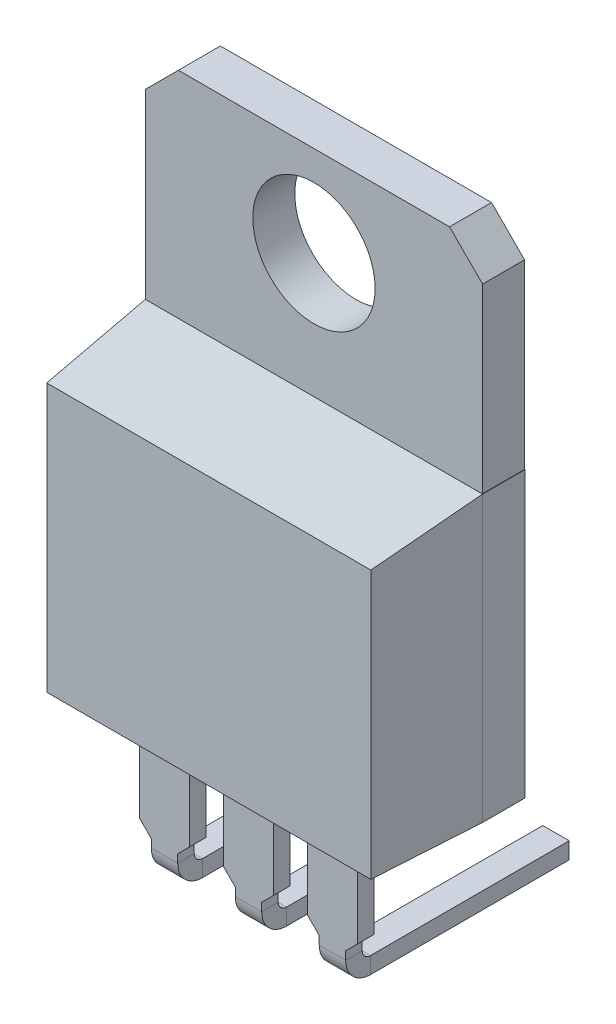
from build123d import *

# Parameters (mm, degrees)
ESQUISSE1_W              = 10.2
ESQUISSE1_H              = 15.1
ESQUISSE1_R              = 1.85
BOSS_EXTRU_1_DEPTH       = 1.27
ESQUISSE2_W              = 10.2
ESQUISSE2_H              = 8.6
BOSS_EXTRU_2_DEPTH       = 3.18
ENL_V_MAT_EXTRU_1_DEPTH  = 11.944062317
ENL_V_MAT_EXTRU_2_DEPTH  = 19.757731739
ESQUISSE5_W              = 1.5
ESQUISSE5_H              = 0.5
BOSS_EXTRU_3_DEPTH       = 3.1
ESQUISSE6_W              = 0.8
ESQUISSE6_H              = 0.5
BOSS_EXTRU_4_DEPTH       = 3.5
CHANFREIN1_SIZE          = 0.35
CHANFREIN2_SIZE          = 1
ESQUISSE8_W              = 1.27
ESQUISSE8_H              = 5.5
ENL_V_MAT_EXTRU_4_DEPTH  = 0.01
ESQUISSE9_W              = 1.27
ESQUISSE9_H              = 5.5
ENL_V_MAT_EXTRU_5_DEPTH  = 0.01
BOSS_EXTRU_6_DEPTH       = 0.01
ESQUISSE12_W             = 5.88
ESQUISSE12_H             = 3.15
ENL_V_MAT_EXTRU_15_DEPTH = 17.267993115
BALAYAGE1_START          = -2.94
BALAYAGE1_DEPTH          = 0.8
BALAYAGE2_START          = 2.14
BALAYAGE2_DEPTH          = 0.8
BALAYAGE3_START          = -0.4
BALAYAGE3_DEPTH          = 0.8


# Read off the part's stored shape, not the designer's step: Balayage1, Balayage2, Balayage3
with BuildPart() as part:
    # Esquisse1 → Boss.-Extru.1 (new body)
    with BuildSketch(Plane.XY):
        with Locations((0, 7.55)):
            Rectangle(ESQUISSE1_W, ESQUISSE1_H)
        with Locations((0, 12.36)):
            Circle(ESQUISSE1_R, mode=Mode.SUBTRACT)
    extrude(amount=BOSS_EXTRU_1_DEPTH)

    # Esquisse2 → Boss.-Extru.2 (add)
    with BuildSketch(Plane.XY.offset(1.27)):
        with Locations((0, 4.3)):
            Rectangle(ESQUISSE2_W, ESQUISSE2_H)
    extrude(amount=BOSS_EXTRU_2_DEPTH)

    # Esquisse3 → Enlèv. mat.-Extru.1 (cut, through all)
    with BuildSketch(Plane(origin=(0, 8.6, 0), x_dir=(1, 0, 0), z_dir=(0, 1, 0))):
        Polygon((5.1, -1.27), (4.9, -4.45), (5.1, -4.45), align=None)
        Polygon((-5.1, -1.27), (-5.1, -4.45), (-4.9, -4.45), align=None)
    extrude(amount=-ENL_V_MAT_EXTRU_1_DEPTH, mode=Mode.SUBTRACT)

    # Esquisse4 → Enlèv. mat.-Extru.2 (cut, through all)
    with BuildSketch(Plane(origin=(5.1, 0, 0), x_dir=(0, 0, -1), z_dir=(1, 0, 0))):
        Polygon((-1.27, 8.6), (-4.45, 8.1), (-4.45, 8.6), align=None)
    extrude(amount=-ENL_V_MAT_EXTRU_2_DEPTH, mode=Mode.SUBTRACT)

    # Esquisse5 → Boss.-Extru.3 (add)
    with BuildSketch(Plane.XZ):
        with Locations((0, 3)):
            Rectangle(ESQUISSE5_W, ESQUISSE5_H)
        with Locations((2.54, 3)):
            Rectangle(ESQUISSE5_W, ESQUISSE5_H)
        with Locations((-2.54, 3)):
            Rectangle(ESQUISSE5_W, ESQUISSE5_H)
    extrude(amount=BOSS_EXTRU_3_DEPTH)

    # Esquisse6 → Boss.-Extru.4 (add)
    with BuildSketch(Plane.XZ.offset(3.1)):
        with Locations((-2.54, 3)):
            Rectangle(ESQUISSE6_W, ESQUISSE6_H)
        with Locations((0, 3)):
            Rectangle(ESQUISSE6_W, ESQUISSE6_H)
        with Locations((2.54, 3)):
            Rectangle(ESQUISSE6_W, ESQUISSE6_H)
    extrude(amount=BOSS_EXTRU_4_DEPTH)

    # Chanfrein1
    chanfrein1_edges = [part.edges().sort_by_distance(p)[0] for p in [
        (2.94, -3.1, 3),
        (0.4, -3.1, 3),
        (-2.14, -3.1, 3),
        (2.14, -3.1, 3),
        (-0.4, -3.1, 3),
        (-2.94, -3.1, 3),
    ]]
    chamfer(chanfrein1_edges, length=CHANFREIN1_SIZE - 0.0001)  # a hair under: the kernel refuses the full size

    # Chanfrein2
    chanfrein2_edges = [part.edges().sort_by_distance(p)[0] for p in [
        (-5.1, 15.1, 0.635),
        (5.1, 15.1, 0.635),
    ]]
    chamfer(chanfrein2_edges, length=CHANFREIN2_SIZE)

    # Esquisse8 → Enlèv. mat.-Extru.4 (cut)
    with BuildSketch(Plane(origin=(5.1, 0, 0), x_dir=(0, 0, -1), z_dir=(1, 0, 0))):
        with Locations((-0.635, 11.35)):
            Rectangle(ESQUISSE8_W, ESQUISSE8_H)
    extrude(amount=-ENL_V_MAT_EXTRU_4_DEPTH, mode=Mode.SUBTRACT)

    # Esquisse9 → Enlèv. mat.-Extru.5 (cut)
    with BuildSketch(Plane.ZY.offset(5.1)):
        with Locations((0.635, 11.35)):
            Rectangle(ESQUISSE9_W, ESQUISSE9_H)
    extrude(amount=-ENL_V_MAT_EXTRU_5_DEPTH, mode=Mode.SUBTRACT)

    # Esquisse11 → Boss.-Extru.6 (add)
    with BuildSketch(Plane(origin=(0, 0, 0), x_dir=(-1, 0, 0), z_dir=(0, 0, -1))):
        Polygon((-5.1, 0), (-5.1, 8.6), (-3.6, 8.6), (-3.6, 2), (3.59, 2), (3.59, 8.6), (5.09, 8.6), (5.1, 0), align=None)
    extrude(amount=BOSS_EXTRU_6_DEPTH)

    # Esquisse12 → Enlèv. mat.-Extru.15 (cut, through all)
    with BuildSketch(Plane.XY.offset(3.25)):
        with Locations((0, -5.025)):
            Rectangle(ESQUISSE12_W, ESQUISSE12_H)
    extrude(amount=-ENL_V_MAT_EXTRU_15_DEPTH, mode=Mode.SUBTRACT)

    # Balayage1 outline → Balayage1 (add)
    with BuildSketch(Plane.YZ.offset(BALAYAGE1_START)):
        with BuildLine():
            Line((-4.45, 2.5), (-4.45, -3.51))
            Line((-4.45, -3.51), (-3.95, -3.51))
            Line((-3.95, -3.51), (-3.95, 2.5))
            ThreePointArc((-3.95, 2.5), (-3.876776695, 2.676776695), (-3.7, 2.75))
            Line((-3.7, 2.75), (-3.45, 2.750000001))
            Line((-3.45, 2.750000001), (-3.45, 3.25))
            Line((-3.45, 3.25), (-3.7, 3.25))
            ThreePointArc((-3.7, 3.25), (-4.230330086, 3.030330086), (-4.45, 2.5))
        make_face()
    extrude(amount=BALAYAGE1_DEPTH)

    # Balayage2 outline → Balayage2 (add)
    with BuildSketch(Plane.YZ.offset(BALAYAGE2_START)):
        with BuildLine():
            Line((-4.45, 2.5), (-4.45, -3.51))
            Line((-4.45, -3.51), (-3.95, -3.51))
            Line((-3.95, -3.51), (-3.95, 2.5))
            ThreePointArc((-3.95, 2.5), (-3.876776695, 2.676776695), (-3.7, 2.75))
            Line((-3.7, 2.75), (-3.45, 2.750000001))
            Line((-3.45, 2.750000001), (-3.45, 3.25))
            Line((-3.45, 3.25), (-3.7, 3.25))
            ThreePointArc((-3.7, 3.25), (-4.230330086, 3.030330086), (-4.45, 2.5))
        make_face()
    extrude(amount=BALAYAGE2_DEPTH)

    # Balayage3 outline → Balayage3 (add)
    with BuildSketch(Plane.YZ.offset(BALAYAGE3_START)):
        with BuildLine():
            Line((-4.45, 2.5), (-4.45, -3.51))
            Line((-4.45, -3.51), (-3.95, -3.51))
            Line((-3.95, -3.51), (-3.95, 2.5))
            ThreePointArc((-3.95, 2.5), (-3.876776695, 2.676776695), (-3.7, 2.75))
            Line((-3.7, 2.75), (-3.45, 2.750000001))
            Line((-3.45, 2.750000001), (-3.45, 3.25))
            Line((-3.45, 3.25), (-3.7, 3.25))
            ThreePointArc((-3.7, 3.25), (-4.230330086, 3.030330086), (-4.45, 2.5))
        make_face()
    extrude(amount=BALAYAGE3_DEPTH)


solid = part.part
